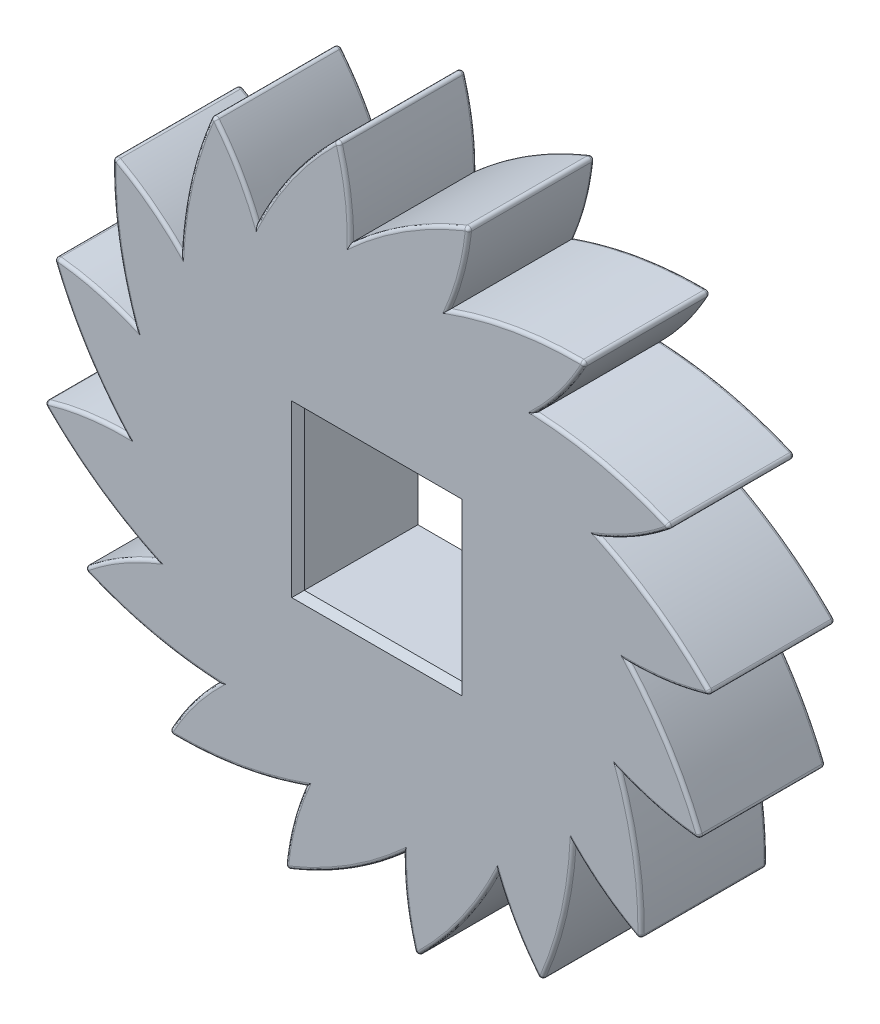
from build123d import *

# Parameters (mm, degrees)
SKETCH1_R           = 7.366
SKETCH1_W           = 3.175
SKETCH1_H           = 3.175
BOSS_EXTRUDE1_DEPTH = 2.54
CUT_EXTRUDE1_DEPTH  = 11.722290427
CIRPATTERN1_COUNT   = 16
CHAMFER1_SIZE       = 0.127
FILLET2_R           = 0.0635


with BuildPart() as part:
    # Sketch1 → Boss-Extrude1 (new body)
    with BuildSketch(Plane.XY):
        Circle(SKETCH1_R)
        Rectangle(SKETCH1_W, SKETCH1_H, mode=Mode.SUBTRACT)
    extrude(amount=BOSS_EXTRUDE1_DEPTH)

    # Sketch2 → Cut-Extrude1 (cut, through all)
    with BuildSketch(Plane.XY.offset(2.54)):
        with BuildLine():
            ThreePointArc((2.783715975, 6.819742031), (0.924102075, 7.307803456), (-0.998467037, 7.298014769))
            add(Edge.make_bspline(
                [(-0.532929906, 5.051968499), (-0.526059014, 6.2290055), (-0.998467037, 7.298014769)],
                knots=[0, 0, 0, 1, 1, 1], degree=2))
            add(Edge.make_bspline(
                [(-0.532929906, 5.051968499), (0.913778754, 6.344612475), (2.783715975, 6.819742031)],
                knots=[0, 0, 0, 1, 1, 1], degree=2))
        make_face()
    cut_extrude1 = extrude(amount=-CUT_EXTRUDE1_DEPTH, mode=Mode.SUBTRACT)

    # CirPattern1: Cut-Extrude1 ×16 about axis
    cirpattern1_axis = Axis((0, 0, 2.54), (0, 0, 1))
    for i in range(1, CIRPATTERN1_COUNT):
        add(cut_extrude1.rotate(cirpattern1_axis, i * 360 / CIRPATTERN1_COUNT), mode=Mode.SUBTRACT)

    # Chamfer1
    chamfer1_edges = [part.edges().sort_by_distance(p)[0] for p in [
        (0, -1.5875, 2.54),
        (1.5875, 0, 2.54),
        (0, 1.5875, 2.54),
        (-1.5875, 0, 2.54),
        (0, 1.5875, 0),
        (1.5875, 0, 0),
        (-1.5875, 0, 0),
        (0, -1.5875, 0),
    ]]
    chamfer(chamfer1_edges, length=CHAMFER1_SIZE)

    # Fillet2
    fillet2_edges = [part.edges().sort_by_distance(p)[0] for p in [
        (-5.921198977, -3.302344675, 1.2699997),
        (-4.206721948, -5.316913402, 1.2699997),
        (-1.851809636, -6.522030263, 1.2699997),
        (0.785023906, -6.734227138, 1.2699997),
        (3.302344675, -5.921198977, 1.2699997),
        (5.316913402, -4.206721948, 1.2699997),
        (6.522030263, -1.851809636, 1.2699997),
        (6.734227138, 0.785023906, 1.2699997),
        (5.921198977, 3.302344675, 1.2699997),
        (4.206721948, 5.316913402, 1.2699997),
        (1.851809636, 6.522030263, 1.2699997),
        (-0.785023906, 6.734227138, 1.2699997),
        (-3.302344675, 5.921198977, 1.2699997),
        (-6.734227138, -0.785023906, 1.2699997),
        (-5.316913402, 4.206721948, 1.2699997),
        (-6.522030263, 1.851809636, 1.2699997),
        (-5.219346206, 2.803737933, 0),
        (-5.219346206, 2.803737934, 2.54),
        (-5.680531125, 1.711426938, 0),
        (-5.680531125, 1.711426937, 2.54),
        (5.680531125, -1.711426937, 2.54),
        (5.219346206, -2.803737934, 2.54),
        (4.593191706, -3.754997467, 2.54),
        (3.749103077, -4.587673413, 2.54),
        (1.711426937, 5.680531125, 2.54),
        (2.803737934, 5.219346206, 2.54),
        (4.587673413, 3.749103077, 2.54),
        (3.754997467, 4.593191706, 2.54),
        (5.673177202, 1.70809299, 2.54),
        (5.226903672, 2.806580487, 2.54),
        (5.894991189, -0.592958771, 2.54),
        (5.903061175, 0.59269283, 2.54),
        (4.593191705, -3.754997468, 0),
        (5.680531125, -1.711426938, 0),
        (5.219346206, -2.803737933, 0),
        (5.894991188, -0.59295877, 0),
        (1.711426939, 5.680531131, 0),
        (2.803737933, 5.219346206, 0),
        (3.754997468, 4.593191705, 0),
        (4.587673412, 3.749103077, 0),
        (5.226903672, 2.806580486, 0),
        (5.903061175, 0.592692829, 0),
        (5.673177201, 1.70809299, 0),
        (-0.592692829, 5.903061175, 0),
        (0.592958773, 5.89499119, 0),
        (-1.70809299, 5.673177201, 0),
        (-2.806580486, 5.226903672, 0),
        (-2.806580487, 5.226903672, 2.54),
        (-0.59269283, 5.903061175, 2.54),
        (0.592958771, 5.894991189, 2.54),
        (-1.70809299, 5.673177202, 2.54),
        (-4.593191706, 3.754997467, 2.54),
        (-3.749103077, 4.587673413, 2.54),
        (-3.749103077, 4.587673412, 0),
        (-4.593191705, 3.754997468, 0),
        (-5.903061175, -0.59269283, 2.54),
        (-5.894991189, 0.592958771, 2.54),
        (-3.754997467, -4.593191706, 2.54),
        (0.592692829, -5.903061175, 0),
        (-1.711426938, -5.680531125, 0),
        (-1.711426937, -5.680531125, 2.54),
        (-2.803737934, -5.219346206, 2.54),
        (-5.226903672, -2.806580487, 2.54),
        (-5.673177202, -1.70809299, 2.54),
        (-4.587673413, -3.749103077, 2.54),
        (-3.754997468, -4.593191705, 0),
        (-4.587673412, -3.749103077, 0),
        (-5.226903672, -2.806580486, 0),
        (-5.903061175, -0.592692829, 0),
        (-5.894991188, 0.59295877, 0),
        (-5.673177201, -1.70809299, 0),
        (-2.803737933, -5.219346206, 0),
        (2.806580486, -5.226903672, 0),
        (2.806580487, -5.226903672, 2.54),
        (1.70809299, -5.673177202, 2.54),
        (0.59269283, -5.903061175, 2.54),
        (-0.592958771, -5.894991189, 2.54),
        (-0.59295877, -5.894991188, 0),
        (1.70809299, -5.673177201, 0),
        (3.749103077, -4.587673412, 0),
    ]]
    fillet(fillet2_edges, radius=FILLET2_R)


solid = part.part
